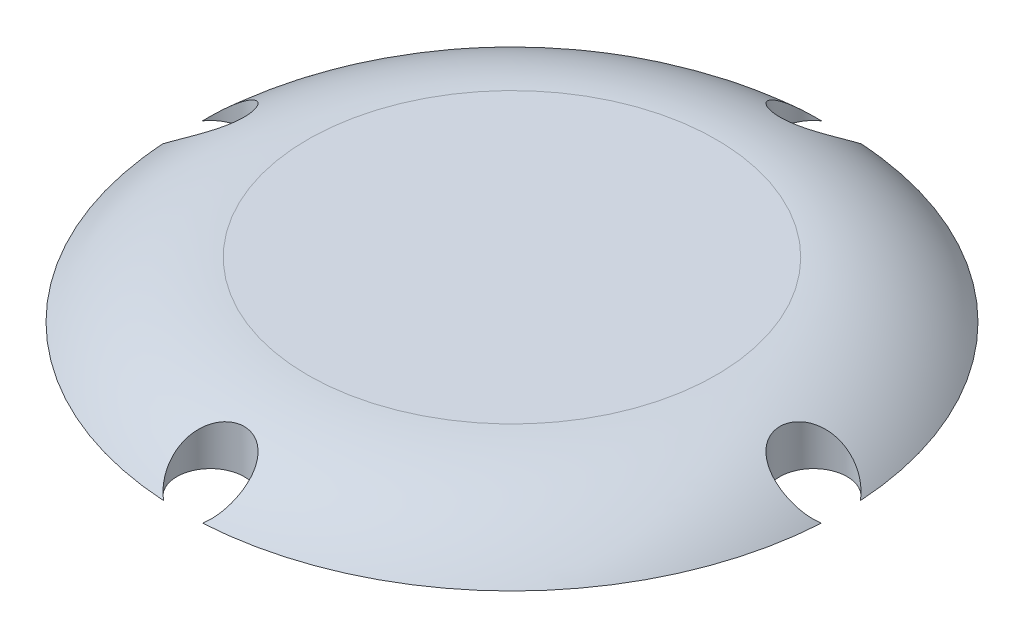
from build123d import *

# Parameters (mm, degrees)
CROQUIS1_R              = 58.8
SALIENTE_EXTRUIR1_DEPTH = 10
REDONDEO1_R             = 30
CROQUIS2_R              = 34.614627086
CORTAR_EXTRUIR1_DEPTH   = 5
CROQUIS3_R              = 6
CORTAR_EXTRUIR2_DEPTH   = 32


with BuildPart() as part:
    # Croquis1 → Saliente-Extruir1 (new body)
    with BuildSketch(Plane(origin=(0, 0, 0), x_dir=(1, 0, 0), z_dir=(0, 1, 0))):
        with Locations(Location((0, 0, 0), (0, 0, 270))):
            Circle(CROQUIS1_R)
    extrude(amount=SALIENTE_EXTRUIR1_DEPTH)

    # Redondeo1
    # the kernel refuses this fillet: 30 mm, written as the material it takes off along each edge
    with BuildSketch(Plane(origin=(0, 10, 0), x_dir=(0, 0, 1), z_dir=(-1, 0, 0))) as redondeo1_piece_1:
        with BuildLine():
            CenterArc((36.439320225, -30), REDONDEO1_R, 41.810314896, 48.189685104)
            Line((36.439320225, 0), (36.439320225, 0.6))
            Line((36.439320225, 0.6), (58.8, 0.6))
            Line((58.8, 0.6), (59.4, 0))
            ThreePointArc((59.4, 0), (59.4, -5), (59.247213595, -9.6))
            Line((59.247213595, -9.6), (58.8, -10))
        make_face()
    revolve(axis=Axis((0, 10, 0), (0, 1, 0)), mode=Mode.SUBTRACT)

    # Croquis2 → Cortar-Extruir1 (cut)
    with BuildSketch(Plane(origin=(0, 0, 0), x_dir=(-1, 0, 0), z_dir=(0, -1, 0))):
        with Locations(Location((0, 0, 0), (0, 0, 90))):
            Circle(CROQUIS2_R)
    extrude(amount=-CORTAR_EXTRUIR1_DEPTH, mode=Mode.SUBTRACT)

    # Croquis3 → Cortar-Extruir2 (cut)
    with BuildSketch(Plane(origin=(0, 0, 0), x_dir=(-1, 0, 0), z_dir=(0, -1, 0))):
        with Locations((0, -53.8)):
            Circle(CROQUIS3_R)
        with Locations((-53.8, 0)):
            Circle(CROQUIS3_R)
        with Locations((0, 53.8)):
            Circle(CROQUIS3_R)
        with Locations((53.8, 0)):
            Circle(CROQUIS3_R)
    extrude(amount=-CORTAR_EXTRUIR2_DEPTH, mode=Mode.SUBTRACT)


solid = part.part
